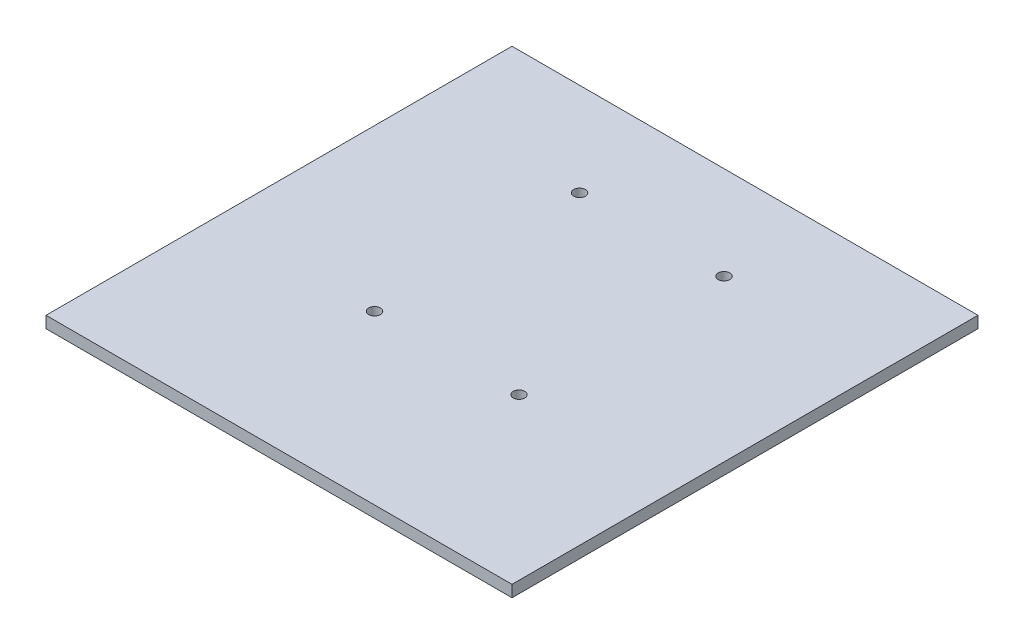
from build123d import *

# Parameters (mm, degrees)
SKETCH1_W           = 127
SKETCH1_H           = 127
SKETCH1_R           = 1.5875
BOSS_EXTRUDE1_DEPTH = 3.175


with BuildPart() as part:
    # Sketch1 → Boss-Extrude1 (new body)
    with BuildSketch(Plane(origin=(0, 0, 0), x_dir=(1, 0, 0), z_dir=(0, 1, 0))):
        with Locations((63.5, 63.5)):
            Rectangle(SKETCH1_W, SKETCH1_H)
        with Locations((43.815, 101.6)):
            Circle(SKETCH1_R, mode=Mode.SUBTRACT)
        with Locations((83.185, 101.6)):
            Circle(SKETCH1_R, mode=Mode.SUBTRACT)
        with Locations((43.815, 45.72)):
            Circle(SKETCH1_R, mode=Mode.SUBTRACT)
        with Locations((83.185, 45.72)):
            Circle(SKETCH1_R, mode=Mode.SUBTRACT)
    extrude(amount=BOSS_EXTRUDE1_DEPTH)


solid = part.part
